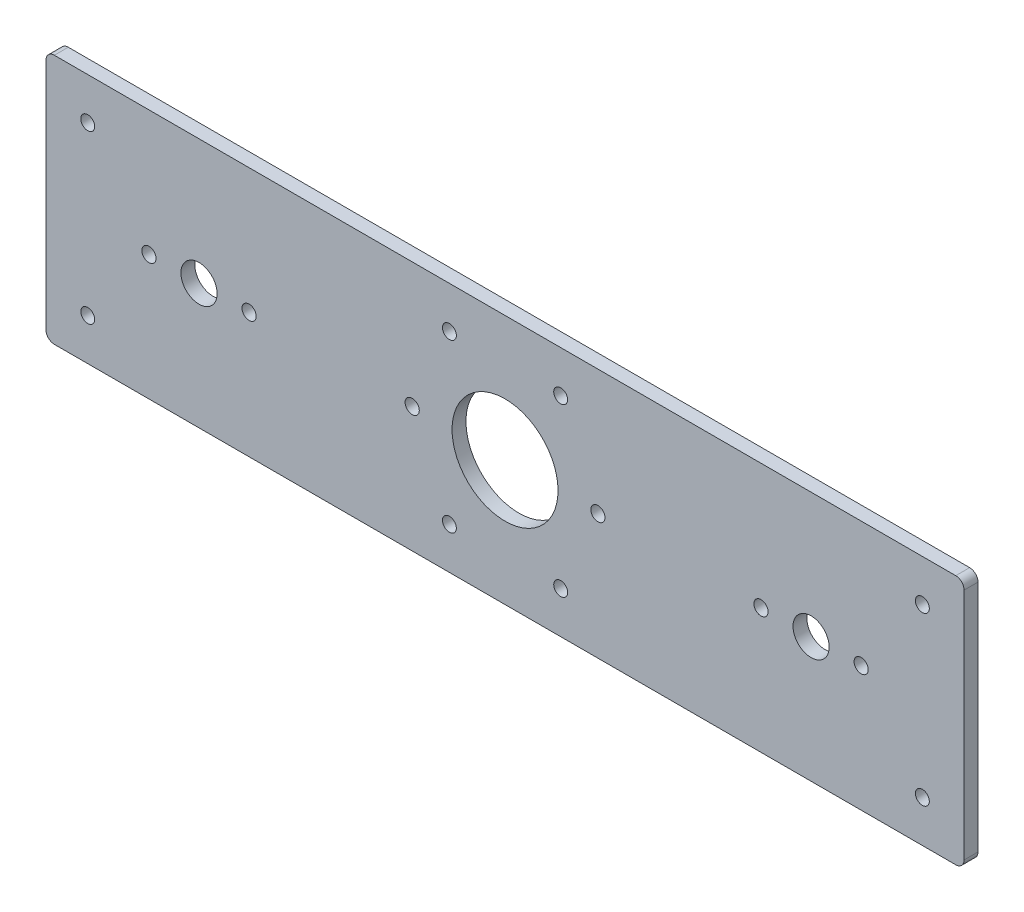
from build123d import *

# Parameters (mm, degrees)
SKETCH1_W           = 330
SKETCH1_H           = 90
SKETCH1_R           = 19.05
SKETCH1_R_2         = 2.55
BOSS_EXTRUDE1_DEPTH = 2.5
SKETCH2_R           = 2.5
CUT_EXTRUDE1_DEPTH  = 172.099386323
SKETCH3_R           = 2.55
SKETCH3_R_2         = 6.5
CUT_EXTRUDE2_DEPTH  = 172.099386323
FILLET1_R           = 3


with BuildPart() as part:
    # Sketch1 → Boss-Extrude1 (new, symmetric)
    with BuildSketch(Plane.XY):
        Rectangle(SKETCH1_W, SKETCH1_H)
        Circle(SKETCH1_R, mode=Mode.SUBTRACT)
        with Locations((-33.375440072, 0)):
            Circle(SKETCH1_R_2, mode=Mode.SUBTRACT)
        with Locations((33.375440072, 0)):
            Circle(SKETCH1_R_2, mode=Mode.SUBTRACT)
    extrude(amount=BOSS_EXTRUDE1_DEPTH, both=True)

    # Sketch2 → Cut-Extrude1 (cut, through all)
    with BuildSketch(Plane.XY.offset(2.5)):
        with Locations((-150, 30)):
            Circle(SKETCH2_R)
        with Locations((-150, -30)):
            Circle(SKETCH2_R)
        with Locations((-20, 30)):
            Circle(SKETCH2_R)
        with Locations((-20, -30)):
            Circle(SKETCH2_R)
        with Locations((20, -30)):
            Circle(SKETCH2_R)
        with Locations((20, 30)):
            Circle(SKETCH2_R)
        with Locations((150, 30)):
            Circle(SKETCH2_R)
        with Locations((150, -30)):
            Circle(SKETCH2_R)
    extrude(amount=-CUT_EXTRUDE1_DEPTH, mode=Mode.SUBTRACT)

    # Sketch3 → Cut-Extrude2 (cut, through all)
    with BuildSketch(Plane.XY.offset(2.5)):
        with Locations((-92, 0)):
            Circle(SKETCH3_R)
        with Locations((-128, 0)):
            Circle(SKETCH3_R)
        with Locations((-110, 0)):
            Circle(SKETCH3_R_2)
    cut_extrude2 = extrude(amount=-CUT_EXTRUDE2_DEPTH, mode=Mode.SUBTRACT)

    # Mirror1: Cut-Extrude2 across plane
    add(cut_extrude2.mirror(Plane(origin=(0, 0, 0), x_dir=(0, 0, 1), z_dir=(1, 0, 0))), mode=Mode.SUBTRACT)

    # Fillet1
    fillet1_edges = [part.edges().sort_by_distance(p)[0] for p in [
        (-165, -45, 0),
        (165, -45, 0),
        (165, 45, 0),
        (-165, 45, 0),
    ]]
    fillet(fillet1_edges, radius=FILLET1_R)


solid = part.part
